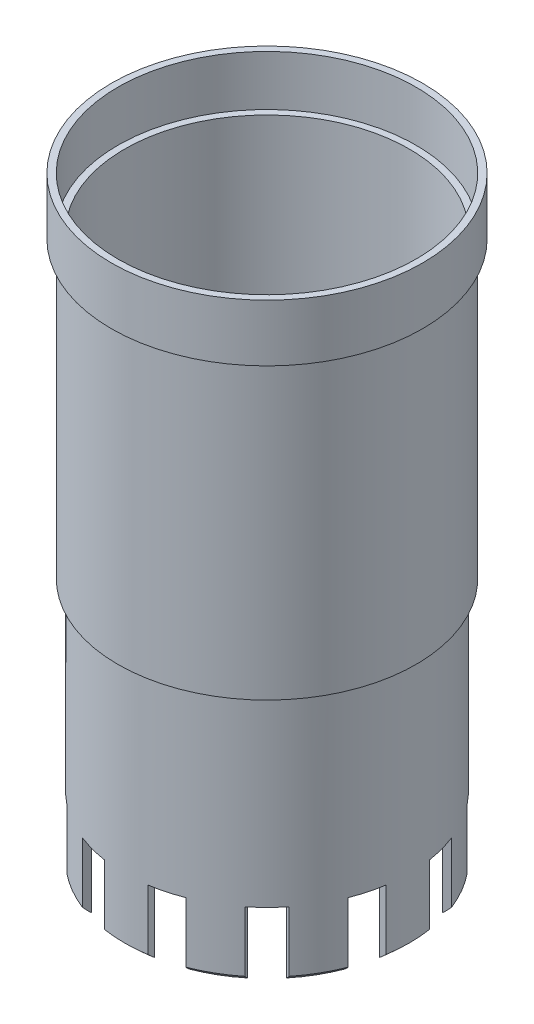
from build123d import *
from build123d.topology import SkipClean

# Parameters (mm, degrees)
REVOLVE_1_ANGLE          = 180
SHELL_1_T                = -150
CUT_EXTRUDE_1_DEPTH      = 18660.782956937
EXTRUDE_1_REACH          = 14147.141
EXTRUDE_1_END_RADIUS     = 3120.833333333
SKETCH_3_R               = 2150
SKETCH_3_R_2             = 2050
SKETCH_4_R               = 3482.688790768
SKETCH_4_W               = 650
SKETCH_4_H               = 200
CUT_EXTRUDE_2_DEPTH      = 4190.568828001
PATTERN_CIRCULAR_2_COUNT = 12
EXTRUDE_2_DEPTH          = 4440
EXTRUDE_2_DEPTH_BACK     = 100
SKETCH_5_R               = 2250
SKETCH_5_R_2             = 2150
EXTRUDE_3_DEPTH          = 760
EXTRUDE_3_DEPTH_BACK     = 100
SKETCH_6_R               = 2350
SKETCH_6_R_2             = 2250


# Read off the part's stored shape, not the designer's step: 交差2
with BuildPart() as part:
    # ｽｹｯﾁ1 → 回転1 (revolve)
    with BuildSketch(Plane.XY):
        with BuildLine():
            Line((2750, 8400), (2750, -8500))
            ThreePointArc((2750, -8500), (1566.245510768, -9600.616769741), (0, -10000))
            Line((0, -10000), (0, 8400))
            Line((0, 8400), (2750, 8400))
        make_face()
    revolve(axis=Axis((0, 8400, 0), (0, -1, 0)), revolution_arc=REVOLVE_1_ANGLE)

    # ｼｪﾙ1
    shell_1_openings = [part.faces().sort_by_distance(p)[0] for p in [
        (0, -583.603631578, 0),
    ]]
    offset(amount=SHELL_1_T, openings=shell_1_openings)

    # ｽｹｯﾁ2 → ｶｯﾄ - 押し出し1 (cut, through all)
    with BuildSketch(Plane.XZ.offset(-8250)):
        with BuildLine():
            Line((-2600, 0), (2600, 0))
            ThreePointArc((2600, 0), (0, 2600), (-2600, 0))
        make_face()
    extrude(amount=-CUT_EXTRUDE_1_DEPTH, mode=Mode.SUBTRACT)

    # ﾐﾗｰ1: part across plane


with BuildPart() as part_1:
    with SkipClean():  # the faces are left unmerged after this step: merging them gives an invalid solid
        add(part.part)
        add(part.part.mirror(Plane.XY))


with BuildPart() as body_2:
    # ﾎﾞｽ - 押し出し1: up to this sphere (the profile starts inside it)
    extrude_1_end = Location((0, -6729.166666667, 0)) * Sphere(EXTRUDE_1_END_RADIUS, mode=Mode.PRIVATE)
    # ｽｹｯﾁ3 → ﾎﾞｽ - 押し出し1 (new, up to the surface)
    with BuildSketch(Plane(origin=(0, -5200, 0), x_dir=(1, 0, 0), z_dir=(0, 1, 0)), mode=Mode.PRIVATE) as extrude_1_sk1:
        with Locations(Location((0, 0, 0), (0, 0, 270))):
            Circle(SKETCH_3_R)
        with Locations(Location((0, 0, 0), (0, 0, 270))):
            Circle(SKETCH_3_R_2, mode=Mode.SUBTRACT)
    extrude_1_tool1 = extrude(extrude_1_sk1.sketch, amount=-EXTRUDE_1_REACH, mode=Mode.PRIVATE) & extrude_1_end
    add(extrude_1_tool1.solids().sort_by_distance((0, -5200, -2089.188817))[0])


with BuildPart() as body_2_2:
    # 交差2: the piece on the far side of the plane
    add(body_2.part)
    split(bisect_by=Plane(origin=(0, -8082.271146804, 0), x_dir=(1, 0, 0), z_dir=(0, 1, 0)), keep=Keep.BOTTOM)

    # ｽｹｯﾁ4 → ｶｯﾄ - 押し出し2 (cut, through all)
    with BuildSketch(Plane(origin=(0, -8082.271146804, 0), x_dir=(1, 0, 0), z_dir=(0, 1, 0))):
        Circle(SKETCH_4_R)
        with Locations((0, 2050)):
            Rectangle(SKETCH_4_W, SKETCH_4_H, mode=Mode.SUBTRACT)
    extrude(amount=-CUT_EXTRUDE_2_DEPTH, mode=Mode.SUBTRACT)


with BuildPart() as body_2_1:
    add(body_2.part)

    # 交差2
    split(bisect_by=Plane(origin=(0, -8082.271146804, 0), x_dir=(1, 0, 0), z_dir=(0, 1, 0)), keep=Keep.TOP)


with BuildPart() as pattern_circular_2_1:
    # 円形ﾊﾟﾀｰﾝ2: pattern copy
    add(body_2_2.part.rotate(Axis((0, 0, 0), (0, 1, 0)), 1 * 360 / PATTERN_CIRCULAR_2_COUNT))


with BuildPart() as pattern_circular_2_2:
    # 円形ﾊﾟﾀｰﾝ2: pattern copy
    add(body_2_2.part.rotate(Axis((0, 0, 0), (0, 1, 0)), 2 * 360 / PATTERN_CIRCULAR_2_COUNT))


with BuildPart() as pattern_circular_2_3:
    # 円形ﾊﾟﾀｰﾝ2: pattern copy
    add(body_2_2.part.rotate(Axis((0, 0, 0), (0, 1, 0)), 3 * 360 / PATTERN_CIRCULAR_2_COUNT))


with BuildPart() as pattern_circular_2_4:
    # 円形ﾊﾟﾀｰﾝ2: pattern copy
    add(body_2_2.part.rotate(Axis((0, 0, 0), (0, 1, 0)), 4 * 360 / PATTERN_CIRCULAR_2_COUNT))


with BuildPart() as pattern_circular_2_5:
    # 円形ﾊﾟﾀｰﾝ2: pattern copy
    add(body_2_2.part.rotate(Axis((0, 0, 0), (0, 1, 0)), 5 * 360 / PATTERN_CIRCULAR_2_COUNT))


with BuildPart() as pattern_circular_2_6:
    # 円形ﾊﾟﾀｰﾝ2: pattern copy
    add(body_2_2.part.rotate(Axis((0, 0, 0), (0, 1, 0)), 6 * 360 / PATTERN_CIRCULAR_2_COUNT))


with BuildPart() as pattern_circular_2_7:
    # 円形ﾊﾟﾀｰﾝ2: pattern copy
    add(body_2_2.part.rotate(Axis((0, 0, 0), (0, 1, 0)), 7 * 360 / PATTERN_CIRCULAR_2_COUNT))


with BuildPart() as pattern_circular_2_8:
    # 円形ﾊﾟﾀｰﾝ2: pattern copy
    add(body_2_2.part.rotate(Axis((0, 0, 0), (0, 1, 0)), 8 * 360 / PATTERN_CIRCULAR_2_COUNT))


with BuildPart() as pattern_circular_2_9:
    # 円形ﾊﾟﾀｰﾝ2: pattern copy
    add(body_2_2.part.rotate(Axis((0, 0, 0), (0, 1, 0)), 9 * 360 / PATTERN_CIRCULAR_2_COUNT))


with BuildPart() as pattern_circular_2_10:
    # 円形ﾊﾟﾀｰﾝ2: pattern copy
    add(body_2_2.part.rotate(Axis((0, 0, 0), (0, 1, 0)), 10 * 360 / PATTERN_CIRCULAR_2_COUNT))


with BuildPart() as pattern_circular_2_11:
    # 円形ﾊﾟﾀｰﾝ2: pattern copy
    add(body_2_2.part.rotate(Axis((0, 0, 0), (0, 1, 0)), 11 * 360 / PATTERN_CIRCULAR_2_COUNT))


with BuildPart() as body_2_2_1:
    add(body_2_2.part)

    # Combine 2: union 円形ﾊﾟﾀｰﾝ2_11, 円形ﾊﾟﾀｰﾝ2_10, 円形ﾊﾟﾀｰﾝ2_9, 円形ﾊﾟﾀｰﾝ2_8, 円形ﾊﾟﾀｰﾝ2_7, 円形ﾊﾟﾀｰﾝ2_6, 円形ﾊﾟﾀｰﾝ2_5, 円形ﾊﾟﾀｰﾝ2_4, 円形ﾊﾟﾀｰﾝ2_3, 円形ﾊﾟﾀｰﾝ2_2, 円形ﾊﾟﾀｰﾝ2_1, body 2
    add(pattern_circular_2_11.part)
    add(pattern_circular_2_10.part)
    add(pattern_circular_2_9.part)
    add(pattern_circular_2_8.part)
    add(pattern_circular_2_7.part)
    add(pattern_circular_2_6.part)
    add(pattern_circular_2_5.part)
    add(pattern_circular_2_4.part)
    add(pattern_circular_2_3.part)
    add(pattern_circular_2_2.part)
    add(pattern_circular_2_1.part)
    add(body_2_1.part)

    # ｽｹｯﾁ5 → ﾎﾞｽ - 押し出し2 (add, two sides: drawn at the far end of the back side and taken through both)
    with BuildSketch(Plane(origin=(0, -5200, 0), x_dir=(1, 0, 0), z_dir=(0, 1, 0)).offset(-EXTRUDE_2_DEPTH_BACK)):
        with Locations(Location((0, 0, 0), (0, 0, 270))):
            Circle(SKETCH_5_R)
        with Locations(Location((0, 0, 0), (0, 0, 270))):
            Circle(SKETCH_5_R_2, mode=Mode.SUBTRACT)
    extrude(amount=EXTRUDE_2_DEPTH + EXTRUDE_2_DEPTH_BACK)

    # ｽｹｯﾁ6 → ﾎﾞｽ - 押し出し3 (add, two sides: drawn at the far end of the back side and taken through both)
    with BuildSketch(Plane(origin=(0, -760, 0), x_dir=(1, 0, 0), z_dir=(0, 1, 0)).offset(-EXTRUDE_3_DEPTH_BACK)):
        with Locations(Location((0, 0, 0), (0, 0, 270))):
            Circle(SKETCH_6_R)
        with Locations(Location((0, 0, 0), (0, 0, 270))):
            Circle(SKETCH_6_R_2, mode=Mode.SUBTRACT)
    extrude(amount=EXTRUDE_3_DEPTH + EXTRUDE_3_DEPTH_BACK)


solid = body_2_2_1.part
